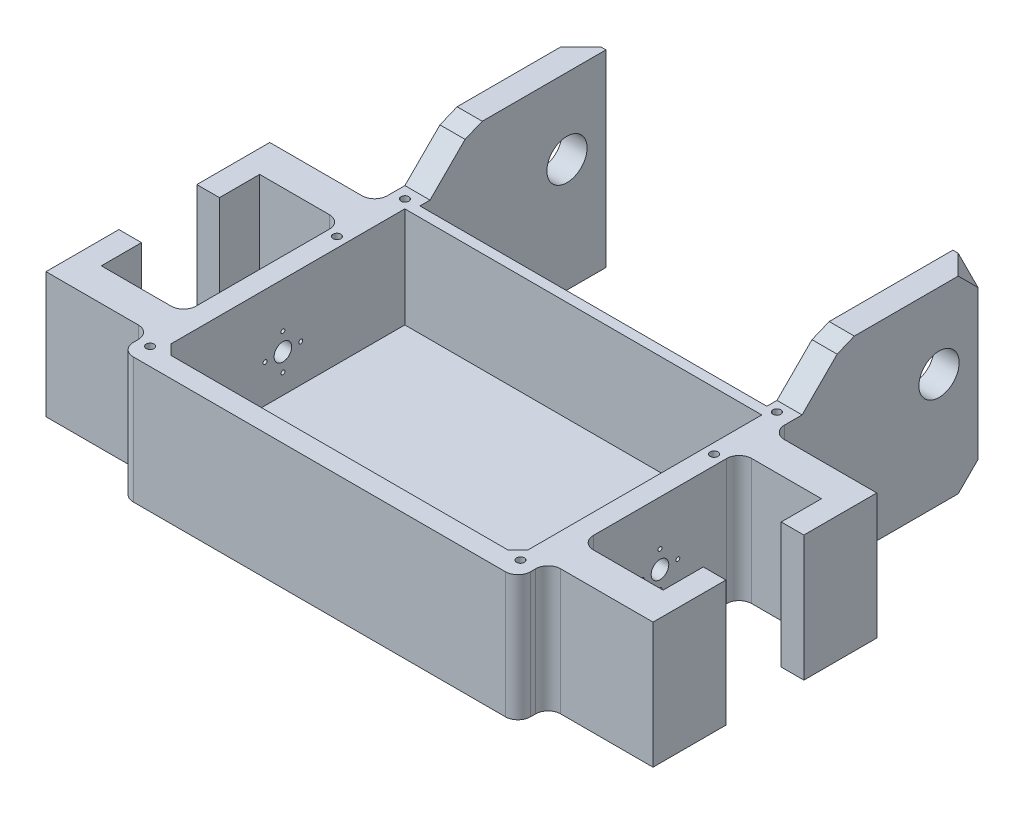
from build123d import *

# Parameters (mm, degrees)
BOSS_EXTRUDE1_DEPTH      = 50.8
BOSS_EXTRUDE1_DEPTH_BACK = 12.7
SKETCH3_W                = 200.66
SKETCH3_H                = 143.51
SKETCH3_W_2              = 180.34
SKETCH3_H_2              = 123.19
SKETCH3_3_W              = 180.34
SKETCH3_3_H              = 123.19
BOSS_EXTRUDE2_DEPTH      = 12.7
BOSS_EXTRUDE3_DEPTH      = 63.5
CUT_EXTRUDE1_DEPTH       = 269.463806918
CUT_EXTRUDE1_DEPTH_BACK  = 269.463806918
SKETCH5_R                = 4.445
SKETCH5_R_2              = 1.000000032
SKETCH5_R_3              = 1
FILLET1_R                = 6.35
SKETCH7_W                = 88.9
SKETCH7_H                = 95.25
BOSS_EXTRUDE4_DEPTH      = 12.7
CHAMFER1_SIZE            = 21.336
CHAMFER2_START           = -163
CHAMFER2_OUTLINE_W       = 17
CHAMFER2_OUTLINE_H       = 17
CHAMFER2_DEPTH           = 6.818277269
CHAMFER3_START           = -193
CHAMFER3_OUTLINE_W       = 15
CHAMFER3_OUTLINE_H       = 17
CHAMFER3_DEPTH           = 6.465208093
CHAMFER4_SIZE            = 5.08
CHAMFER5_SIZE            = 5.08
FILLET3_R                = 10.16
CHAMFER6_SIZE            = 5.08
CUT_EXTRUDE2_DEPTH       = 299.446905332
CUT_EXTRUDE2_DEPTH_BACK  = 299.446905332
SKETCH8_R                = 10.16
SKETCH9_R                = 2
SKETCH9_R_2              = 2.000000064
CUT_EXTRUDE3_DEPTH       = 12.7


with BuildPart() as part:
    # Sketch3 → Boss-Extrude1 (new, two sides: drawn at the far end of the back side and taken through both)
    with BuildSketch(Plane(origin=(0, 0, 0), x_dir=(1, 0, 0), z_dir=(0, 1, 0)).offset(-BOSS_EXTRUDE1_DEPTH_BACK)):
        Rectangle(SKETCH3_W, SKETCH3_H)
        Rectangle(SKETCH3_W_2, SKETCH3_H_2, mode=Mode.SUBTRACT)
    extrude(amount=BOSS_EXTRUDE1_DEPTH + BOSS_EXTRUDE1_DEPTH_BACK)

    # Sketch3<3> → Boss-Extrude2 (add)
    with BuildSketch(Plane(origin=(0, 0, 0), x_dir=(1, 0, 0), z_dir=(0, 1, 0))):
        Rectangle(SKETCH3_3_W, SKETCH3_3_H)
    extrude(amount=-BOSS_EXTRUDE2_DEPTH)

    # Sketch4 → Boss-Extrude3 (add)
    with BuildSketch(Plane(origin=(0, -12.7, 0), x_dir=(-1, 0, 0), z_dir=(0, -1, 0))):
        Polygon((153.329999918, 56.515), (100.33, 56.515), (100.33, 40.005), (141.899999918, 40.005), (141.899999918, 19.685), (153.329999918, 19.685), align=None)
        Polygon((141.9, -40.005), (100.33, -40.005), (100.33, -56.515), (153.33, -56.515), (153.33, -19.685), (141.9, -19.685), align=None)
        Polygon((-100.33, 40.005), (-100.33, 56.515), (-153.329999918, 56.515), (-153.329999918, 19.685), (-141.899999918, 19.685), (-141.899999918, 40.005), align=None)
        Polygon((-100.33, -40.005), (-141.9, -40.005), (-141.9, -19.685), (-153.33, -19.685), (-153.33, -56.515), (-100.33, -56.515), align=None)
    extrude(amount=-BOSS_EXTRUDE3_DEPTH)

    # Sketch5 → Cut-Extrude1 (cut, two sides: drawn at the far end of the back side and taken through both)
    with BuildSketch(Plane.ZY.offset(100.33).offset(-CUT_EXTRUDE1_DEPTH_BACK)):
        with Locations(Location((0, 19.05, 0), (0, 0, 180))):
            Circle(SKETCH5_R)
        with Locations(Location((-9.017, 19.05, 0), (0, 0, 180))):
            Circle(SKETCH5_R_2)
        with Locations(Location((9.017, 19.05, 0), (0, 0, 180))):
            Circle(SKETCH5_R_3)
        with Locations(Location((0.017538483, 28.067, 0), (0, 0, 180))):
            Circle(SKETCH5_R_3)
        with Locations(Location((-0.055629344, 10.033, 0), (0, 0, 180))):
            Circle(SKETCH5_R_3)
    extrude(amount=CUT_EXTRUDE1_DEPTH + CUT_EXTRUDE1_DEPTH_BACK, mode=Mode.SUBTRACT)

    # Fillet1
    fillet1_edges = [part.edges().sort_by_distance(p)[0] for p in [
        (100.33, 19.05, -56.515),
        (100.33, 19.05, -40.005),
        (-100.33, 19.05, -40.005),
        (-100.33, 19.05, -56.515),
        (-100.33, 19.05, 40.005),
        (-100.33, 19.05, 56.515),
        (100.33, 19.05, 71.755),
        (-100.33, 19.05, 71.755),
        (100.33, 19.05, 56.515),
        (100.33, 19.05, 40.005),
    ]]
    fillet(fillet1_edges, radius=FILLET1_R)

    # Sketch7 → Boss-Extrude4 (add)
    with BuildSketch(Plane.ZY.offset(100.33)):
        with Locations((-116.205, 24.477736962)):
            Rectangle(SKETCH7_W, SKETCH7_H)
    extrude(amount=-BOSS_EXTRUDE4_DEPTH)

    # Chamfer1
    # the kernel refuses this chamfer: 21.336 mm, written as the material it takes off along each edge
    with BuildSketch(Plane(origin=(-155.199428231, 72.102736962, -71.755), x_dir=(0, -1, 0), z_dir=(1, 0, 0))) as chamfer1_piece_1_section:
        Polygon((CHAMFER1_SIZE, 0), (0, CHAMFER1_SIZE), (0, 0), align=None)
    chamfer1_piece_1 = extrude(amount=122.438856462, mode=Mode.PRIVATE)
    chamfer1_piece_1 = split(chamfer1_piece_1, bisect_by=Plane(origin=(-155.199428231, 50.8, -71.755), z_dir=(0, 1, 0)), keep=Keep.TOP, mode=Mode.PRIVATE)
    add(chamfer1_piece_1, mode=Mode.SUBTRACT)
    with BuildSketch(Plane(origin=(-155.199428231, -23.147263038, -71.755), x_dir=(0, 1, 0), z_dir=(1, 0, 0))) as chamfer1_piece_2_section:
        Polygon((CHAMFER1_SIZE, 0), (0, -CHAMFER1_SIZE), (0, 0), align=None)
    chamfer1_piece_2 = extrude(amount=122.438856462, mode=Mode.PRIVATE)
    chamfer1_piece_2 = split(chamfer1_piece_2, bisect_by=Plane(origin=(-155.199428231, -12.7, -71.755), z_dir=(0, -1, 0)), keep=Keep.TOP, mode=Mode.PRIVATE)
    add(chamfer1_piece_2, mode=Mode.SUBTRACT)

    # Chamfer2: read off the stored shape, not the designer's step
    # Chamfer2 outline → Chamfer2 (cut)
    with BuildSketch(Plane(origin=(0, 0, 0), x_dir=(0.8737038499063027, -0.34397789366389886, -0.34397789366389886), z_dir=(0.4864582023760161, 0.6178019170175401, 0.6178019170175401)).offset(CHAMFER2_START)):
        with Locations((-20.5, 97.5)):
            Rectangle(CHAMFER2_OUTLINE_W, CHAMFER2_OUTLINE_H)
    extrude(amount=CHAMFER2_DEPTH, mode=Mode.SUBTRACT)

    # Chamfer3: read off the stored shape, not the designer's step
    # Chamfer3 outline → Chamfer3 (cut)
    with BuildSketch(Plane(origin=(0, 0, 0), x_dir=(0.8164965809277258, 0.40824829046386313, -0.40824829046386313), z_dir=(0.5773502691896258, -0.5773502691896258, 0.5773502691896258)).offset(CHAMFER3_START)):
        with Locations((15.5, -62.5)):
            Rectangle(CHAMFER3_OUTLINE_W, CHAMFER3_OUTLINE_H)
    extrude(amount=CHAMFER3_DEPTH, mode=Mode.SUBTRACT)

    # Chamfer4
    chamfer4_edges = [part.edges().sort_by_distance(p)[0] for p in [
        (-90.17, 25.4, 61.595),
        (90.17, 25.4, 61.595),
    ]]
    chamfer(chamfer4_edges, length=CHAMFER4_SIZE)

    # Chamfer5
    chamfer5_edges = [part.edges().sort_by_distance(p)[0] for p in [
        (6.35, 50.8, -71.755),
    ]]
    chamfer(chamfer5_edges, length=CHAMFER5_SIZE)

    # Fillet3
    fillet3_edges = [part.edges().sort_by_distance(p)[0] for p in [
        (-87.63, 16.51, -71.755),
    ]]
    fillet(fillet3_edges, radius=FILLET3_R)

    # Chamfer6
    chamfer6_edges = [part.edges().sort_by_distance(p)[0] for p in [
        (-93.98, 72.102736962, -93.091),
    ]]
    chamfer(chamfer6_edges, length=CHAMFER6_SIZE)

    # Mirror1: part across plane


with BuildPart() as part_1:
    add(part.part)
    add(part.part.mirror(Plane.ZY))

    # Sketch8 → Cut-Extrude2 (cut, two sides: drawn at the far end of the back side and taken through both)
    with BuildSketch(Plane(origin=(-87.63, 0, 0), x_dir=(0, 0, -1), z_dir=(1, 0, 0)).offset(-CUT_EXTRUDE2_DEPTH_BACK)):
        with Locations((140.97, 34.002736962)):
            Circle(SKETCH8_R)
    extrude(amount=CUT_EXTRUDE2_DEPTH + CUT_EXTRUDE2_DEPTH_BACK, mode=Mode.SUBTRACT)

    # Sketch9 → Cut-Extrude3 (cut)
    with BuildSketch(Plane(origin=(0, 50.8, 0), x_dir=(1, 0, 0), z_dir=(0, 1, 0))):
        with Locations(Location((-94.488, 65.948922821, 0), (0, 0, 270))):
            Circle(SKETCH9_R)
        with Locations(Location((-95.25, 32.385, 0), (0, 0, 270))):
            Circle(SKETCH9_R)
        with Locations(Location((-94.361, -62.865, 0), (0, 0, 270))):
            Circle(SKETCH9_R_2)
        with Locations(Location((92.71, -62.865, 0), (0, 0, 270))):
            Circle(SKETCH9_R)
        with Locations(Location((92.71, 66.675, 0), (0, 0, 270))):
            Circle(SKETCH9_R)
        with Locations(Location((95.25, 32.385, 0), (0, 0, 270))):
            Circle(SKETCH9_R)
    extrude(amount=-CUT_EXTRUDE3_DEPTH, mode=Mode.SUBTRACT)


solid = part_1.part
